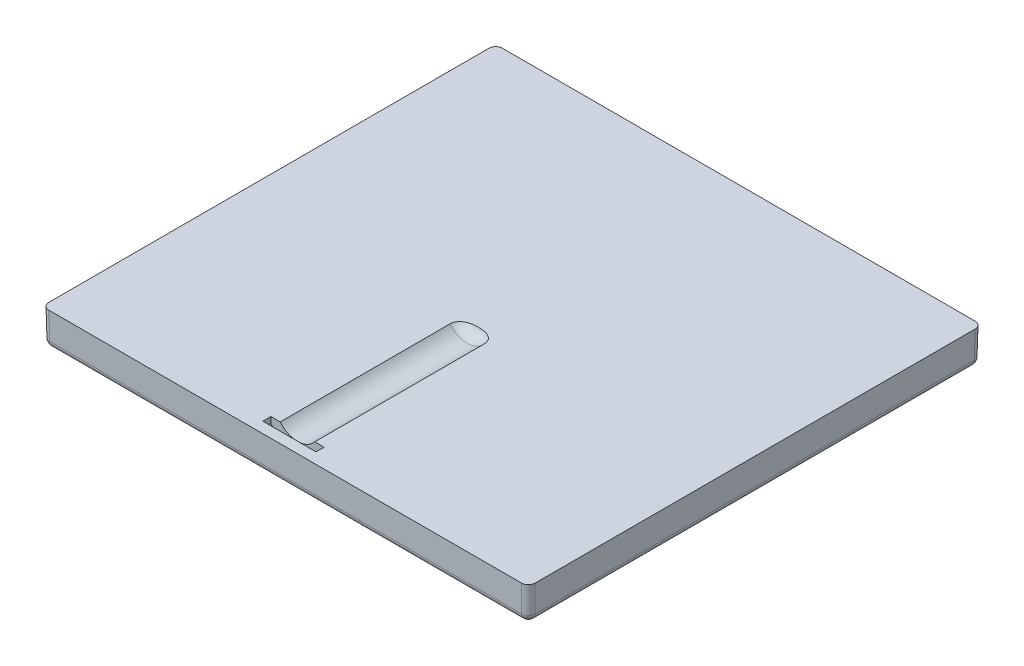
from build123d import *

# Parameters (mm, degrees)
SKETCH1_W           = 215.5
SKETCH1_H           = 201
BOSS_EXTRUDE1_DEPTH = 15
BOSS_EXTRUDE1_DRAFT = -1
FILLET1_R           = 3
CAVITY1_START       = 16.930808083
CAVITY1_DEPTH       = 78.999015724
CAVITY1_START_2     = 92.359823807
CAVITY1_2_DEPTH     = 3.57


with BuildPart() as part:
    # Sketch1 → Boss-Extrude1 (with draft: the straight prism first)
    with BuildSketch(Plane(origin=(0, 0, 0), x_dir=(1, 0, 0), z_dir=(0, 1, 0))):
        Rectangle(SKETCH1_W, SKETCH1_H)
    extrude(amount=BOSS_EXTRUDE1_DEPTH)
    # Boss-Extrude1: the draft: its side faces are tilted about the plane it starts from
    boss_extrude1_sides = [part.faces().sort_by_distance(p)[0] for p in [
        (0, 7.5, 100.5),
        (107.75, 7.5, 0),
        (0, 7.5, -100.5),
        (-107.75, 7.5, 0),
    ]]
    draft(boss_extrude1_sides, Plane(origin=(0, 0, 0), x_dir=(1, 0, 0), z_dir=(0, 1, 0)), BOSS_EXTRUDE1_DRAFT)

    # Fillet1
    fillet1_edges = [part.edges().sort_by_distance(p)[0] for p in [
        (0, 0, 100.5),
        (-107.75, 0, 0),
        (0, 0, -100.5),
        (107.75, 0, 0),
        (107.880912987, 7.5, 100.630912987),
        (-107.880912987, 7.5, 100.630912987),
        (-107.880912987, 7.5, -100.630912987),
        (107.880912987, 7.5, -100.630912987),
    ]]
    fillet(fillet1_edges, radius=FILLET1_R)

    # Cavity1: read off the stored shape, not the designer's step
    # Cavity1 outline → Cavity1 (cut)
    with BuildSketch(Plane.XY.offset(CAVITY1_START)):
        with BuildLine():
            ThreePointArc((-10.617650831, 15), (-2.951958482, 11.347239001), (4.713733868, 15))
            Line((4.713733868, 15), (-10.617650831, 15))
        make_face()
    extrude(amount=CAVITY1_DEPTH, mode=Mode.SUBTRACT)

    # Cavity1 2 outline → Cavity1 2 (cut)
    with BuildSketch(Plane.XY.offset(CAVITY1_START_2)):
        with BuildLine():
            Line((8.860541518, 15), (4.713733868, 15))
            ThreePointArc((4.713733868, 15), (-2.951958482, 11.347239001), (-10.617650831, 15))
            Line((-10.617650831, 15), (-14.764458482, 15))
            Line((-14.764458482, 15), (-14.764458482, 12.397239001))
            Line((-14.764458482, 12.397239001), (-9.251958482, 6.044739001))
            ThreePointArc((-9.251958482, 6.044739001), (-2.951958482, 3.104739001), (3.348041518, 6.044739001))
            Line((3.348041518, 6.044739001), (8.860541518, 12.397239001))
            Line((8.860541518, 12.397239001), (8.860541518, 15))
        make_face()
    extrude(amount=CAVITY1_2_DEPTH, mode=Mode.SUBTRACT)

    # Cavity1 3 outline → Cavity1 3 (revolve, cut)
    with BuildSketch(Plane(origin=(-2.951958482, 21.217239001, 0), x_dir=(1, 0, 0), z_dir=(0, -1, 0))):
        with BuildLine():
            ThreePointArc((6.217239001, 11.929675453), (8.859575731, 13.83427815), (9.87, 16.930808083))
            Line((9.87, 16.930808083), (6.217239001, 16.930808083))
            Line((6.217239001, 16.930808083), (6.217239001, 11.929675453))
        make_face()
    revolve(axis=Axis((-2.951958482, 21.217239001, 0), (0, 0, 1)), mode=Mode.SUBTRACT)


solid = part.part
